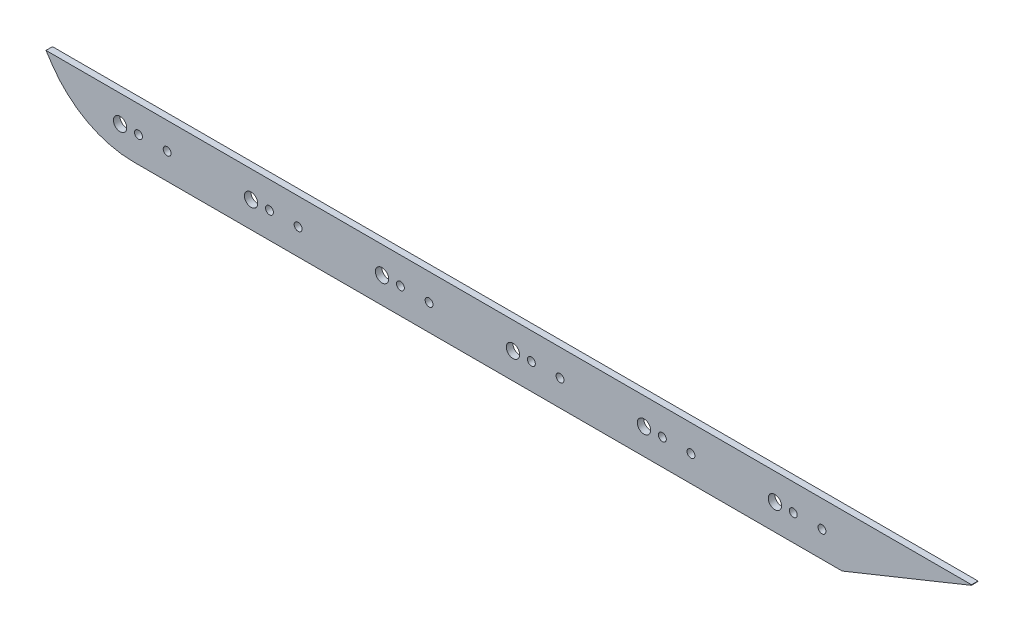
from build123d import *

# Parameters (mm, degrees)
BOSS_EXTRUDE1_DEPTH = 3.175
SKETCH1_4_R         = 3.25
CUT_EXTRUDE1_DEPTH  = 439.905857431
FILLET1_R           = 48
CUT_EXTRUDE3_DEPTH  = 10
CUT_EXTRUDE5_DEPTH  = 10
SKETCH11_R          = 1.925
CUT_EXTRUDE6_DEPTH  = 10


with BuildPart() as part:
    # Sketch1 → Boss-Extrude1 (new body)
    with BuildSketch(Plane.XY):
        Polygon((428.120588235, 28.939617947), (0.540381846, 28.939617947), (-115.605170134, 28.939617947), (-98.879411765, 3.850980392), (-31.879411765, -96.649019608), (366, -96.649019608), (403.120588235, -71.149019608), align=None)
    extrude(amount=BOSS_EXTRUDE1_DEPTH)

    # Sketch1<4> → Cut-Extrude1 (cut, through all)
    with BuildSketch(Plane.XY):
        with Locations((-12.879411765, -83.899019608)):
            Circle(SKETCH1_4_R)
        with Locations((51.120588235, -83.899019608)):
            Circle(SKETCH1_4_R)
        with Locations((115.120588235, -83.899019608)):
            Circle(SKETCH1_4_R)
        with Locations((179.120588235, -83.899019608)):
            Circle(SKETCH1_4_R)
        with Locations((243.120588235, -83.899019608)):
            Circle(SKETCH1_4_R)
        with Locations((307.120588235, -83.899019608)):
            Circle(SKETCH1_4_R)
    extrude(amount=CUT_EXTRUDE1_DEPTH, mode=Mode.SUBTRACT)

    # Fillet1
    fillet1_edges = [part.edges().sort_by_distance(p)[0] for p in [
        (-31.879411765, -96.649019608, 1.5875),
    ]]
    fillet(fillet1_edges, radius=FILLET1_R)

    # Sketch7 → Cut-Extrude3 (cut)
    with BuildSketch(Plane.XY.offset(3.175)):
        Polygon((403.120588235, -71.149019608), (340.005873473, -96.649019608), (366, -96.649019608), align=None)
    extrude(amount=-CUT_EXTRUDE3_DEPTH, mode=Mode.SUBTRACT)

    # Sketch10 → Cut-Extrude5 (cut)
    with BuildSketch(Plane.XY.offset(3.175)):
        Polygon((-49.086078431, -70.839019608), (403.198019602, -70.839019608), (428.120588235, 28.939617947), (-115.605170134, 28.939617947), align=None)
    extrude(amount=-CUT_EXTRUDE5_DEPTH, mode=Mode.SUBTRACT)

    # Sketch11 → Cut-Extrude6 (cut)
    with BuildSketch(Plane.XY.offset(3.175)):
        with Locations((-3.879411765, -83.899019608)):
            Circle(SKETCH11_R)
        with Locations((10.120588235, -83.899019608)):
            Circle(SKETCH11_R)
        with Locations((60.120588235, -83.899019608)):
            Circle(SKETCH11_R)
        with Locations((74.120588235, -83.899019608)):
            Circle(SKETCH11_R)
        with Locations((124.120588235, -83.899019608)):
            Circle(SKETCH11_R)
        with Locations((138.120588235, -83.899019608)):
            Circle(SKETCH11_R)
        with Locations((188.120588235, -83.899019608)):
            Circle(SKETCH11_R)
        with Locations((202.120588235, -83.899019608)):
            Circle(SKETCH11_R)
        with Locations((252.120588235, -83.899019608)):
            Circle(SKETCH11_R)
        with Locations((266.120588235, -83.899019608)):
            Circle(SKETCH11_R)
        with Locations((316.120588235, -83.899019608)):
            Circle(SKETCH11_R)
        with Locations((330.120588235, -83.899019608)):
            Circle(SKETCH11_R)
    extrude(amount=-CUT_EXTRUDE6_DEPTH, mode=Mode.SUBTRACT)


solid = part.part
